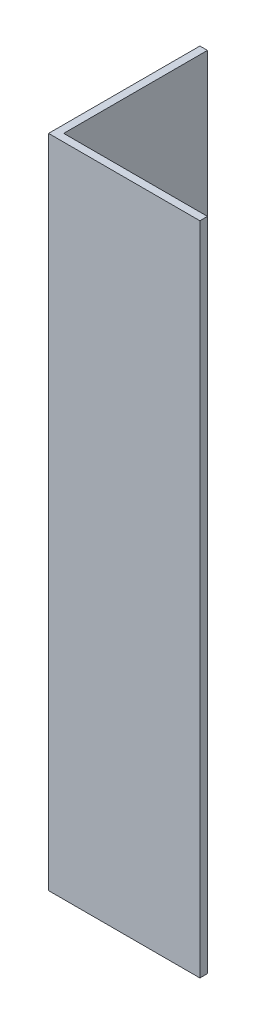
from build123d import *

# Parameters (mm, degrees)
EXTRUDE_1_DEPTH = 65


with BuildPart() as part:
    # Эскиз1 → Бобышка-Вытянуть1 (new body)
    with BuildSketch(Plane(origin=(0, 0, 0), x_dir=(1, 0, 0), z_dir=(0, 1, 0))):
        Polygon((0, 0), (0, 15), (0.75, 15), (0.75, 0.75), (15, 0.75), (15, 0), align=None)
    extrude(amount=EXTRUDE_1_DEPTH)


solid = part.part
